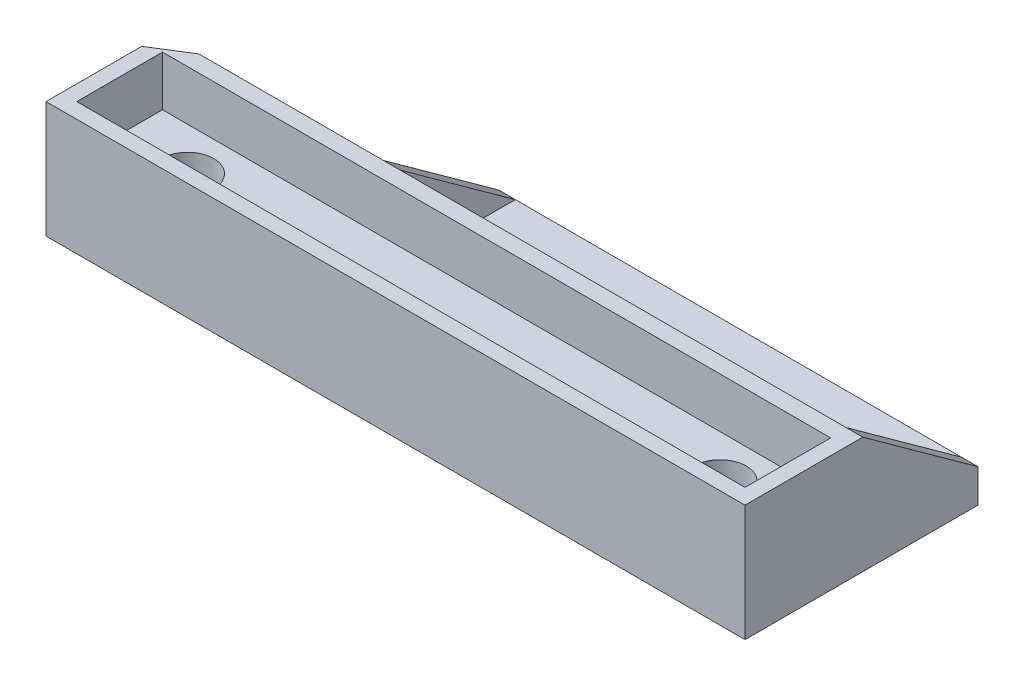
from build123d import *

# Parameters (mm, degrees)
RISER_DEPTH             = 7
SKETCH2_R               = 1.575
MOUNTING_HOLES_DEPTH    = 44.150898021
SKETCH3_W               = 40.15
SKETCH3_H               = 5.15
RECESS_DEPTH            = 3
FLANGE_DEPTH            = 7
SKETCH5_W               = 26.797240136
SKETCH5_H               = 6.925
FLANGE_CUTOUT_DEPTH     = 5
ANGLE_CUTOUT_DEPTH      = 44.886216515
ANGLE_CUTOUT_DEPTH_BACK = 44.886216515
FLANGE_CHAMFER_1_SIZE   = 1
FLANGE_CHAMFER_2_SIZE   = 1


with BuildPart() as part:
    # Sketch1 → Riser (new body)
    with BuildSketch(Plane(origin=(0, 0, 0), x_dir=(1, 0, 0), z_dir=(0, 1, 0))):
        Polygon((2.000418161, 7), (42, 7), (42, 0), (0, 0), (0, 5.75), align=None)
    extrude(amount=RISER_DEPTH)

    # Sketch2 → Mounting Holes (cut, through all)
    with BuildSketch(Plane.XZ):
        with Locations((37, -3.5)):
            Circle(SKETCH2_R)
        with Locations((5, -3.5)):
            Circle(SKETCH2_R)
    extrude(amount=-MOUNTING_HOLES_DEPTH, mode=Mode.SUBTRACT)

    # Sketch3 → Recess (cut)
    with BuildSketch(Plane(origin=(0, 7, 0), x_dir=(1, 0, 0), z_dir=(0, 1, 0))):
        with Locations((21, 3.5)):
            Rectangle(SKETCH3_W, SKETCH3_H)
    extrude(amount=-RECESS_DEPTH, mode=Mode.SUBTRACT)

    # Sketch4 → Flange (add)
    with BuildSketch(Plane(origin=(0, 0, 0), x_dir=(1, 0, 0), z_dir=(0, 1, 0))):
        Polygon((2.000418161, 7), (42, 7), (42, 14), (13.202759864, 14), align=None)
    extrude(amount=FLANGE_DEPTH)

    # Sketch5 → Flange Cutout (cut)
    with BuildSketch(Plane(origin=(0, 7, 0), x_dir=(1, 0, 0), z_dir=(0, 1, 0))):
        with Locations((27.601379932, 10.5375)):
            Rectangle(SKETCH5_W, SKETCH5_H)
        Polygon((2.120443251, 7.075), (13.202759864, 7.075), (13.202759864, 14), align=None)
    extrude(amount=-FLANGE_CUTOUT_DEPTH, mode=Mode.SUBTRACT)

    # Sketch7 → Angle Cutout (cut, two sides: drawn at the far end of the back side and taken through both)
    with BuildSketch(Plane.ZY.offset(-41).offset(-ANGLE_CUTOUT_DEPTH_BACK)):
        Polygon((-7.075, 7), (-14, 2), (-14, 7), align=None)
    extrude(amount=ANGLE_CUTOUT_DEPTH + ANGLE_CUTOUT_DEPTH_BACK, mode=Mode.SUBTRACT)

    # Flange Chamfer 1
    flange_chamfer_1_edges = [part.edges().sort_by_distance(p)[0] for p in [
        (27.601379932, 2, -7.075),
    ]]
    chamfer(flange_chamfer_1_edges, length=FLANGE_CHAMFER_1_SIZE)

    # Flange Chamfer 2
    flange_chamfer_2_edges = [part.edges().sort_by_distance(p)[0] for p in [
        (7.661601558, 2, -7.075),
    ]]
    chamfer(flange_chamfer_2_edges, length=FLANGE_CHAMFER_2_SIZE)


solid = part.part
